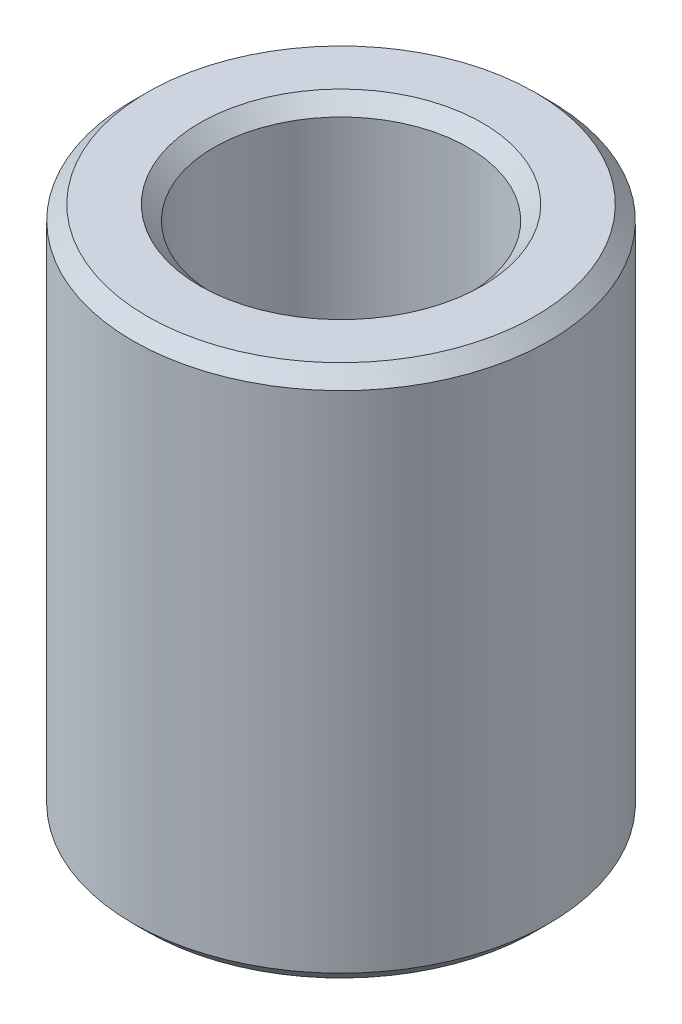
from build123d import *

# Parameters (mm, degrees)
SKETCH1_R           = 50
BOSS_EXTRUDE1_DEPTH = 128.015763778
SKETCH2_R           = 30.519113946
CUT_EXTRUDE1_DEPTH  = 147.246489789
CHAMFER1_SIZE       = 3.406793228


with BuildPart() as part:
    # Sketch1 → Boss-Extrude1 (new body)
    with BuildSketch(Plane(origin=(0, 0, 0), x_dir=(1, 0, 0), z_dir=(0, 1, 0))):
        Circle(SKETCH1_R)
    extrude(amount=BOSS_EXTRUDE1_DEPTH)

    # Sketch2 → Cut-Extrude1 (cut, through all)
    with BuildSketch(Plane(origin=(0, 0, 0), x_dir=(1, 0, 0), z_dir=(0, 1, 0))):
        Circle(SKETCH2_R)
    extrude(amount=CUT_EXTRUDE1_DEPTH, mode=Mode.SUBTRACT)

    # Chamfer1
    chamfer1_edges = [part.edges().sort_by_distance(p)[0] for p in [
        (-30.519113946, 128.015763778, 0),
        (-30.519113946, 0, 0),
        (-50, 0, 0),
        (-50, 128.015763778, 0),
    ]]
    chamfer(chamfer1_edges, length=CHAMFER1_SIZE)


solid = part.part
